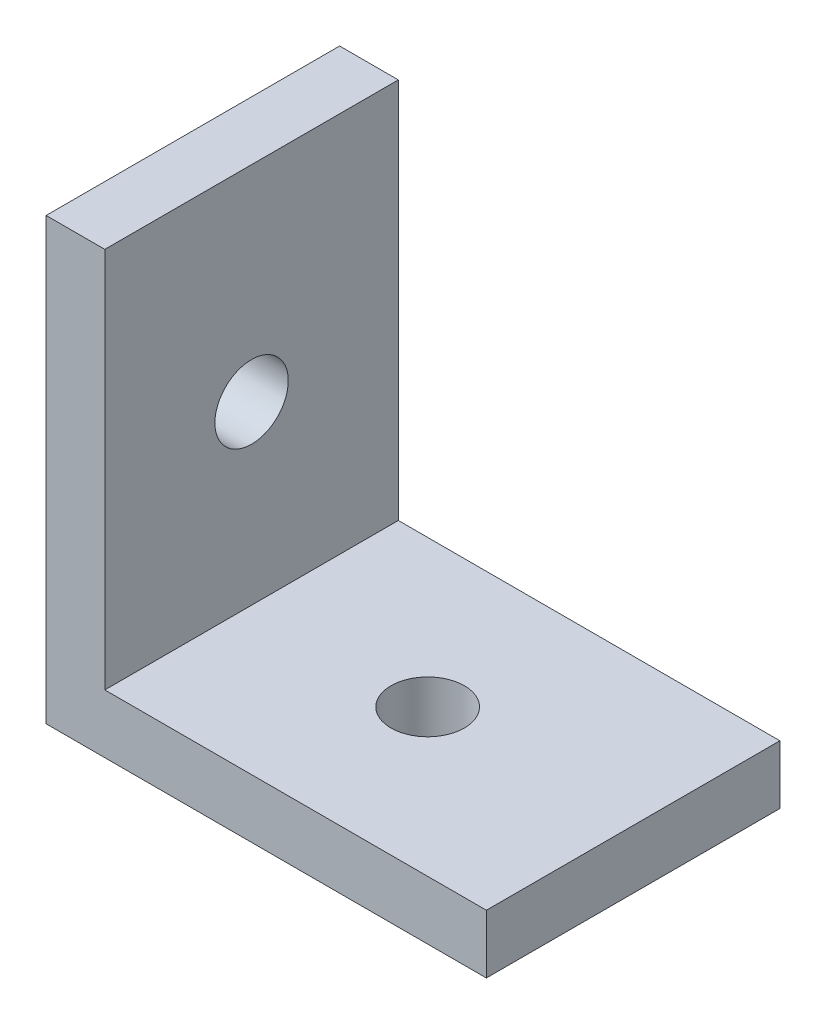
from build123d import *

# Parameters (mm, degrees)
BASE_DEPTH         = 5
SKETCH2_R          = 1.25
CUT_EXTRUDE1_DEPTH = 22.794494718
SKETCH3_R          = 1.25
CUT_EXTRUDE2_DEPTH = 10


with BuildPart() as part:
    # Sketch1 → Base (new, symmetric)
    with BuildSketch(Plane.XY):
        Polygon((0, 0), (0, 15), (2, 15), (2, 2), (15, 2), (15, 0), align=None)
    extrude(amount=BASE_DEPTH, both=True)

    # Sketch2 → Cut-Extrude1 (cut, through all)
    with BuildSketch(Plane.ZY):
        with Locations((0, 8)):
            Circle(SKETCH2_R)
    extrude(amount=-CUT_EXTRUDE1_DEPTH, mode=Mode.SUBTRACT)

    # Sketch3 → Cut-Extrude2 (cut)
    with BuildSketch(Plane.XZ):
        with Locations((8, 0)):
            Circle(SKETCH3_R)
    extrude(amount=-CUT_EXTRUDE2_DEPTH, mode=Mode.SUBTRACT)


solid = part.part
